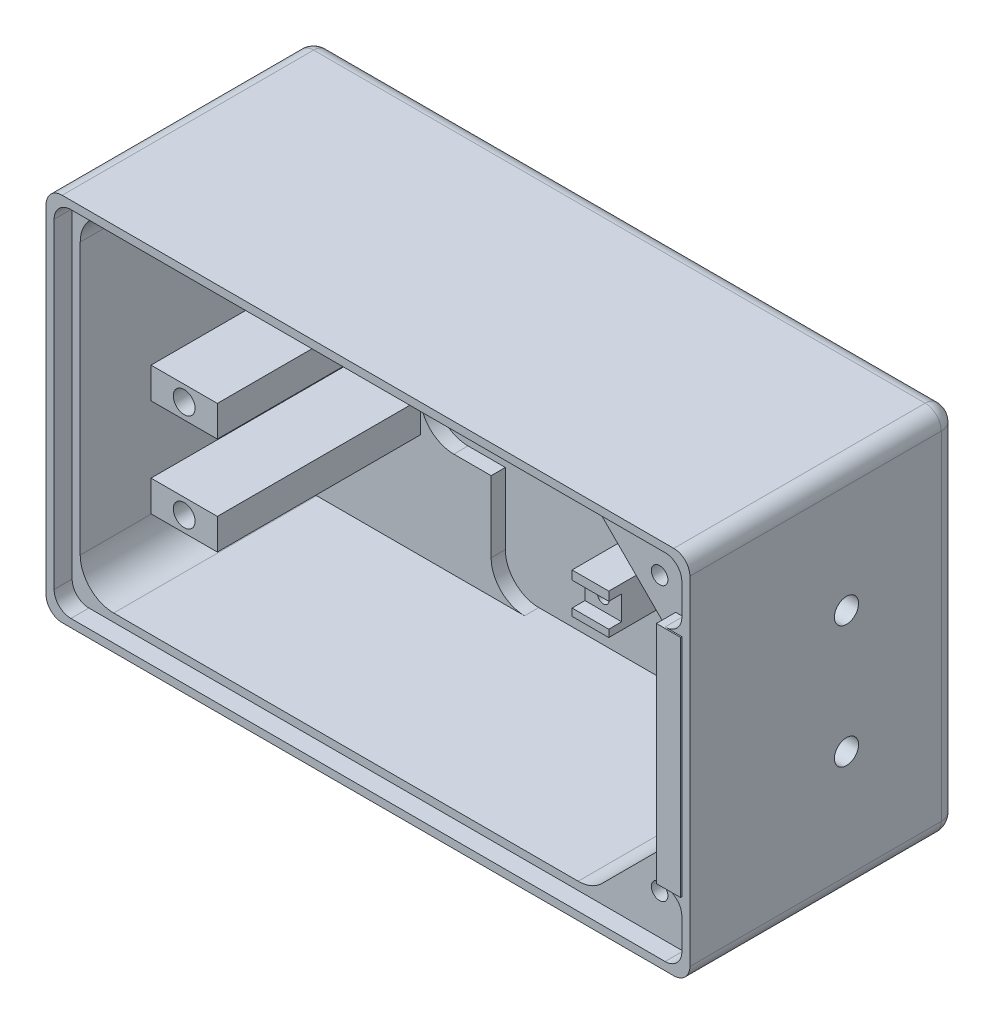
from build123d import *

# Parameters (mm, degrees)
SKETCH1_W                                         = 127
SKETCH1_H                                         = 73.025
BOSS_EXTRUDE1_DEPTH                               = 38.1
SKETCH2_W                                         = 73.025
SKETCH2_H                                         = 66.675
SKETCH2_W_2                                       = 15.24
CUT_EXTRUDE1_DEPTH                                = 31.75
SKETCH3_W                                         = 28.575
SKETCH3_H                                         = 66.675
CUT_EXTRUDE2_DEPTH                                = 1.620624902
SKETCH4_W                                         = 12.7
SKETCH4_H                                         = 22.225
BOSS_EXTRUDE2_DEPTH                               = 30.129375098
SKETCH5_W                                         = 29.845
SKETCH5_H                                         = 66.675
CUT_EXTRUDE3_DEPTH                                = 30.129375098
SKETCH8_W                                         = 7.239
SKETCH8_H                                         = 31.75
BOSS_EXTRUDE3_DEPTH                               = 17.9705
CUT_EXTRUDE4_DEPTH                                = 18.6055
SKETCH7_W                                         = 127
SKETCH7_H                                         = 73.025
CUT_EXTRUDE5_DEPTH                                = 1.620624902
SKETCH9_W                                         = 33.528
SKETCH9_H                                         = 15.875
CUT_EXTRUDE6_DEPTH                                = 17.9705
SKETCH11_W                                        = 127
SKETCH11_H                                        = 73.025
SKETCH11_W_2                                      = 116.84
SKETCH11_H_2                                      = 66.675
BOSS_EXTRUDE4_DEPTH                               = 12.733124902
F_4_40_TAPPED_HOLE1_D                             = 2.2606
F_4_40_TAPPED_HOLE1_DEPTH                         = 7.62
F_4_40_TAPPED_HOLE1_TIP                           = 0.679152758
CHAMFER1_SIZE                                     = 15.875
FILLET2_R                                         = 6.604
CUT_EXTRUDE8_START                                = -30.129375098
CUT_EXTRUDE8_DEPTH                                = 30.129375098
SKETCH15_W                                        = 41.000000042
SKETCH15_H                                        = 20.6375
BOSS_EXTRUDE5_DEPTH                               = 2.8034996
SKETCH16_W                                        = 13.081
SKETCH16_H                                        = 6.096
BOSS_EXTRUDE6_DEPTH                               = 42.8625
FILLET3_R                                         = 6.604
FILLET4_R                                         = 3.175
CSK_FOR_8_FLAT_HEAD_SOCKET_CAP_SCREW1_D           = 4.3053
CSK_FOR_8_FLAT_HEAD_SOCKET_CAP_SCREW1_CSINK_D     = 9.1186
CSK_FOR_8_FLAT_HEAD_SOCKET_CAP_SCREW1_CSINK_ANGLE = 82
CUT_EXTRUDE9_REACH                                = 143.011
SKETCH22_R                                        = 2.3876
F_4_40_TAPPED_HOLE3_D                             = 2.2606
F_4_40_TAPPED_HOLE3_DEPTH                         = 12.7
F_4_40_TAPPED_HOLE3_TIP                           = 0.679152758
CBORE_FOR_4_SOCKET_HEAD_CAP_SCREW1_D              = 3.2639
CBORE_FOR_4_SOCKET_HEAD_CAP_SCREW1_CBORE_D        = 6.35
CBORE_FOR_4_SOCKET_HEAD_CAP_SCREW1_CBORE_DEPTH    = 12.4968
SKETCH30_R                                        = 3.175
CUT_EXTRUDE10_DEPTH                               = 9.525
SKETCH31_W                                        = 6.35
SKETCH31_H                                        = 44.45
BOSS_EXTRUDE7_DEPTH                               = 3.81
SKETCH32_W                                        = 7.239
SKETCH32_H                                        = 31.75
CUT_EXTRUDE11_DEPTH                               = 2.286
BOSS_EXTRUDE9_START                               = -2.8034996
BOSS_EXTRUDE9_DEPTH                               = 2.8034996
BOSS_EXTRUDE10_DEPTH                              = 3.81
BOSS_EXTRUDE11_DEPTH                              = 3.81
SKETCH36_W                                        = 4.7625
SKETCH36_H                                        = 44.45
CUT_EXTRUDE12_DEPTH                               = 0.254
CUT_EXTRUDE14_DEPTH                               = 1.5875
CUT_EXTRUDE15_DEPTH                               = 0.254


with BuildPart() as part:
    # Sketch1 → Boss-Extrude1 (new body)
    with BuildSketch(Plane.XY):
        Rectangle(SKETCH1_W, SKETCH1_H)
    extrude(amount=BOSS_EXTRUDE1_DEPTH)

    # Sketch2 → Cut-Extrude1 (cut)
    with BuildSketch(Plane.XY.offset(38.1)):
        with Locations((20.0025, 0)):
            Rectangle(SKETCH2_W, SKETCH2_H)
        with Locations((-52.705, 0)):
            Rectangle(SKETCH2_W_2, SKETCH2_H)
    extrude(amount=-CUT_EXTRUDE1_DEPTH, mode=Mode.SUBTRACT)

    # Sketch3 → Cut-Extrude2 (cut)
    with BuildSketch(Plane.XY.offset(38.1)):
        with Locations((-30.7975, 0)):
            Rectangle(SKETCH3_W, SKETCH3_H)
    extrude(amount=-CUT_EXTRUDE2_DEPTH, mode=Mode.SUBTRACT)

    # Sketch4 → Boss-Extrude2 (add)
    with BuildSketch(Plane.XY.offset(36.479375098)):
        with Locations((-10.16, -22.225)):
            Rectangle(SKETCH4_W, SKETCH4_H)
        with Locations((-10.16, 22.225)):
            Rectangle(SKETCH4_W, SKETCH4_H)
    extrude(amount=-BOSS_EXTRUDE2_DEPTH)

    # Sketch5 → Cut-Extrude3 (cut)
    with BuildSketch(Plane.XY.offset(36.479375098)):
        with Locations((-30.1625, 0)):
            Rectangle(SKETCH5_W, SKETCH5_H)
    extrude(amount=-CUT_EXTRUDE3_DEPTH, mode=Mode.SUBTRACT)

    # Sketch8 → Boss-Extrude3 (add)
    with BuildSketch(Plane.XY.offset(6.35)):
        with Locations((13.1445, 0)):
            Rectangle(SKETCH8_W, SKETCH8_H)
    extrude(amount=BOSS_EXTRUDE3_DEPTH)

    # Sketch6 → Cut-Extrude4 (cut)
    with BuildSketch(Plane.XY.offset(38.1)):
        with BuildLine():
            Line((6.35, 14.44625), (53.975, 14.44625))
            ThreePointArc((53.975, 14.44625), (56.35625, 12.065), (53.975, 9.68375))
            Line((53.975, 9.68375), (6.35, 9.68375))
            ThreePointArc((6.35, 9.68375), (3.96875, 12.065), (6.35, 14.44625))
        make_face()
        with BuildLine():
            Line((6.35, -14.44625), (53.975, -14.44625))
            ThreePointArc((53.975, -14.44625), (56.35625, -12.065), (53.975, -9.68375))
            Line((53.975, -9.68375), (6.35, -9.68375))
            ThreePointArc((6.35, -9.68375), (3.96875, -12.065), (6.35, -14.44625))
        make_face()
    extrude(amount=-CUT_EXTRUDE4_DEPTH, mode=Mode.SUBTRACT)

    # Sketch7 → Cut-Extrude5 (cut)
    with BuildSketch(Plane.XY.offset(38.1)):
        Rectangle(SKETCH7_W, SKETCH7_H)
    extrude(amount=-CUT_EXTRUDE5_DEPTH, mode=Mode.SUBTRACT)

    # Sketch9 → Cut-Extrude6 (cut)
    with BuildSketch(Plane.XY.offset(24.3205)):
        Rectangle(SKETCH9_W, SKETCH9_H)
    extrude(amount=-CUT_EXTRUDE6_DEPTH, mode=Mode.SUBTRACT)

    # Sketch11 → Boss-Extrude4 (add)
    with BuildSketch(Plane.XY.offset(36.479375098)):
        Rectangle(SKETCH11_W, SKETCH11_H)
        with Locations((-1.905, 0)):
            Rectangle(SKETCH11_W_2, SKETCH11_H_2, mode=Mode.SUBTRACT)
    extrude(amount=BOSS_EXTRUDE4_DEPTH)

    # #4-40 Tapped Hole1
    with Locations(Plane.XY.offset(36.479375098)):
        with Locations((-9.525, 19), (-9.525, -19)):
            Hole(F_4_40_TAPPED_HOLE1_D / 2, depth=F_4_40_TAPPED_HOLE1_DEPTH)
            with Locations((0, 0, -(F_4_40_TAPPED_HOLE1_DEPTH + F_4_40_TAPPED_HOLE1_TIP / 2))):  # 118° drill point
                Cone(0, F_4_40_TAPPED_HOLE1_D / 2, F_4_40_TAPPED_HOLE1_TIP, mode=Mode.SUBTRACT)

    # Chamfer1
    chamfer1_edges = [part.edges().sort_by_distance(p)[0] for p in [
        (56.515, -33.3375, 27.78125),
        (56.515, 33.3375, 27.78125),
    ]]
    chamfer(chamfer1_edges, length=CHAMFER1_SIZE)

    # Fillet2
    fillet2_edges = [part.edges().sort_by_distance(p)[0] for p in [
        (40.64, 33.3375, 27.78125),
        (56.515, -17.4625, 27.78125),
        (56.515, 17.4625, 27.78125),
        (40.64, -33.3375, 27.78125),
        (-60.325, 33.3375, 27.78125),
        (-60.325, -33.3375, 27.78125),
        (-3.81, -33.3375, 21.414687549),
        (-3.81, 33.3375, 21.414687549),
        (-15.24, -33.3375, 21.414687549),
        (-15.24, 33.3375, 21.414687549),
    ]]
    fillet(fillet2_edges, radius=FILLET2_R)

    # Sketch14 → Cut-Extrude8 (cut)
    with BuildSketch(Plane.XY.offset(36.479375098).offset(CUT_EXTRUDE8_START)):
        with BuildLine():
            Line((-15.24, -11.1125), (-15.24, -26.7335))
            ThreePointArc((-15.24, -26.7335), (-17.174266817, -31.403233183), (-21.844, -33.3375))
            Line((-21.844, -33.3375), (2.794, -33.3375))
            ThreePointArc((2.794, -33.3375), (-1.875733183, -31.403233183), (-3.81, -26.7335))
            Line((-3.81, -26.7335), (-3.81, -11.1125))
            Line((-3.81, -11.1125), (-15.24, -11.1125))
        make_face()
        with BuildLine():
            Line((-3.81, 11.1125), (-3.81, 26.7335))
            ThreePointArc((-3.81, 26.7335), (-1.875733183, 31.403233183), (2.794, 33.3375))
            Line((2.794, 33.3375), (-21.844, 33.3375))
            ThreePointArc((-21.844, 33.3375), (-17.174266817, 31.403233183), (-15.24, 26.7335))
            Line((-15.24, 26.7335), (-15.24, 11.1125))
            Line((-15.24, 11.1125), (-3.81, 11.1125))
        make_face()
    extrude(amount=CUT_EXTRUDE8_DEPTH, mode=Mode.SUBTRACT)

    # Sketch15 → Boss-Extrude5 (add)
    with BuildSketch(Plane.XY.offset(6.35)):
        with Locations((-39.824999979, 23.01875)):
            Rectangle(SKETCH15_W, SKETCH15_H)
        with Locations((-39.824999979, -23.01875)):
            Rectangle(SKETCH15_W, SKETCH15_H)
    extrude(amount=BOSS_EXTRUDE5_DEPTH)

    # Sketch16 → Boss-Extrude6 (add)
    with BuildSketch(Plane.XY.offset(6.35)):
        with Locations((-39.8145, 9.652)):
            Rectangle(SKETCH16_W, SKETCH16_H)
        with Locations((-39.8145, -9.652)):
            Rectangle(SKETCH16_W, SKETCH16_H)
    extrude(amount=BOSS_EXTRUDE6_DEPTH)

    # Fillet3
    # the kernel refuses this fillet: 6.604 mm, written as the material it adds along each edge
    with BuildSketch(Plane(origin=(-19.324999958, -33.3375, -10.16), x_dir=(1, 0, 0), z_dir=(0, 0, 1))) as fillet3_piece_1_section:
        with BuildLine():
            CenterArc((FILLET3_R, FILLET3_R), FILLET3_R, 180, 90)
            Line((0, FILLET3_R), (0, 0))
            Line((0, 0), (FILLET3_R, 0))
        make_face()
    fillet3_piece_1 = extrude(amount=19.3134996, mode=Mode.PRIVATE)
    fillet3_piece_1 = split(fillet3_piece_1, bisect_by=Plane(origin=(-17.849878089, -31.862378131, 0), z_dir=(0, 0, 1)), keep=Keep.TOP, mode=Mode.PRIVATE)
    add(fillet3_piece_1)
    with BuildSketch(Plane(origin=(-19.324999958, 33.3375, -10.16), x_dir=(1, 0, 0), z_dir=(0, 0, 1))) as fillet3_piece_2_section:
        with BuildLine():
            CenterArc((FILLET3_R, -FILLET3_R), FILLET3_R, 90, 90)
            Line((0, -FILLET3_R), (0, 0))
            Line((0, 0), (FILLET3_R, 0))
        make_face()
    fillet3_piece_2 = extrude(amount=19.3134996, mode=Mode.PRIVATE)
    fillet3_piece_2 = split(fillet3_piece_2, bisect_by=Plane(origin=(-17.849878089, 31.862378131, 0), z_dir=(0, 0, 1)), keep=Keep.TOP, mode=Mode.PRIVATE)
    add(fillet3_piece_2)
    with BuildSketch(Plane(origin=(-33.274, 12.7, -10.111081374), x_dir=(1, 0, 0), z_dir=(0, 0, 1))) as fillet3_piece_3_section:
        with BuildLine():
            CenterArc((6.58443255, -6.604), FILLET3_R, 90, 85.588274214)
            Line((0, -6.096), (0, 0))
            Line((0, 0), (6.58443255, 0))
        make_face()
    fillet3_piece_3 = extrude(amount=19.264580974, mode=Mode.PRIVATE)
    fillet3_piece_3 = split(fillet3_piece_3, bisect_by=Plane(origin=(-31.18507504, 10.951703165, 0), z_dir=(0, 0, 1)), keep=Keep.TOP, mode=Mode.PRIVATE)
    add(fillet3_piece_3)
    with BuildSketch(Plane(origin=(-33.274, -12.7, -10.111081374), x_dir=(0, 1, 0), z_dir=(0, 0, 1))) as fillet3_piece_4_section:
        with BuildLine():
            CenterArc((6.604, -6.58443255), FILLET3_R, 94.411725786, 85.588274214)
            Line((0, -6.58443255), (0, 0))
            Line((0, 0), (6.096, 0))
        make_face()
    fillet3_piece_4 = extrude(amount=19.264580974, mode=Mode.PRIVATE)
    fillet3_piece_4 = split(fillet3_piece_4, bisect_by=Plane(origin=(-31.18507504, -10.951703165, 0), z_dir=(0, 0, 1)), keep=Keep.TOP, mode=Mode.PRIVATE)
    add(fillet3_piece_4)
    with BuildSketch(Plane(origin=(-46.355, -12.7, -10.111081374), x_dir=(-1, 0, 0), z_dir=(0, 0, 1))) as fillet3_piece_5_section:
        with BuildLine():
            CenterArc((6.58443255, -6.604), FILLET3_R, 90, 85.588274214)
            Line((0, -6.096), (0, 0))
            Line((0, 0), (6.58443255, 0))
        make_face()
    fillet3_piece_5 = extrude(amount=19.264580974, mode=Mode.PRIVATE)
    fillet3_piece_5 = split(fillet3_piece_5, bisect_by=Plane(origin=(-48.44392496, -10.951703165, 0), z_dir=(0, 0, 1)), keep=Keep.TOP, mode=Mode.PRIVATE)
    add(fillet3_piece_5)
    with BuildSketch(Plane(origin=(-60.325, -12.7, -10.16), x_dir=(0, 1, 0), z_dir=(0, 0, 1))) as fillet3_piece_6_section:
        with BuildLine():
            CenterArc((FILLET3_R, -FILLET3_R), FILLET3_R, 90, 90)
            Line((0, -FILLET3_R), (0, 0))
            Line((0, 0), (FILLET3_R, 0))
        make_face()
    fillet3_piece_6 = extrude(amount=19.3134996, mode=Mode.PRIVATE)
    fillet3_piece_6 = split(fillet3_piece_6, bisect_by=Plane(origin=(-58.849878131, -11.224878131, 0), z_dir=(0, 0, 1)), keep=Keep.TOP, mode=Mode.PRIVATE)
    add(fillet3_piece_6)
    with BuildSketch(Plane(origin=(-46.355, 12.7, -10.111081374), x_dir=(-1, 0, 0), z_dir=(0, 0, 1))) as fillet3_piece_7_section:
        with BuildLine():
            CenterArc((6.58443255, 6.604), FILLET3_R, 184.411725786, 85.588274214)
            Line((0, 6.096), (0, 0))
            Line((0, 0), (6.58443255, 0))
        make_face()
    fillet3_piece_7 = extrude(amount=19.264580974, mode=Mode.PRIVATE)
    fillet3_piece_7 = split(fillet3_piece_7, bisect_by=Plane(origin=(-48.44392496, 10.951703165, 0), z_dir=(0, 0, 1)), keep=Keep.TOP, mode=Mode.PRIVATE)
    add(fillet3_piece_7)
    with BuildSketch(Plane(origin=(-60.325, 12.7, -10.16), x_dir=(0, -1, 0), z_dir=(0, 0, 1))) as fillet3_piece_8_section:
        with BuildLine():
            CenterArc((FILLET3_R, FILLET3_R), FILLET3_R, 180, 90)
            Line((0, FILLET3_R), (0, 0))
            Line((0, 0), (FILLET3_R, 0))
        make_face()
    fillet3_piece_8 = extrude(amount=19.3134996, mode=Mode.PRIVATE)
    fillet3_piece_8 = split(fillet3_piece_8, bisect_by=Plane(origin=(-58.849878131, 11.224878131, 0), z_dir=(0, 0, 1)), keep=Keep.TOP, mode=Mode.PRIVATE)
    add(fillet3_piece_8)

    # Fillet4
    fillet4_edges = [part.edges().sort_by_distance(p)[0] for p in [
        (-63.5, 36.5125, 24.60625),
        (63.5, 36.5125, 24.60625),
        (63.5, -36.5125, 24.60625),
        (-63.5, -36.5125, 24.60625),
        (0, 36.5125, 0),
        (63.5, 0, 0),
        (0, -36.5125, 0),
        (-63.5, 0, 0),
    ]]
    fillet(fillet4_edges, radius=FILLET4_R)

    # CSK for #8 Flat Head Socket Cap Screw1 (through all)
    with Locations(Plane(origin=(0, 0, 0), x_dir=(-1, 0, 0), z_dir=(0, 0, -1))):
        with Locations((39.8145, -9.652), (39.8145, 9.652)):
            CounterSinkHole(CSK_FOR_8_FLAT_HEAD_SOCKET_CAP_SCREW1_D / 2, CSK_FOR_8_FLAT_HEAD_SOCKET_CAP_SCREW1_CSINK_D / 2, counter_sink_angle=CSK_FOR_8_FLAT_HEAD_SOCKET_CAP_SCREW1_CSINK_ANGLE)

    # Sketch22 → Cut-Extrude9 (cut, up to next)
    with BuildSketch(Plane(origin=(63.5, 0, 0), x_dir=(0, 0, -1), z_dir=(1, 0, 0)), mode=Mode.PRIVATE) as cut_extrude9_sk1:
        with Locations(Location((-21.87575, -12.065, 0), (0, 0, 90))):
            Circle(SKETCH22_R)
    cut_extrude9_tool1 = extrude(cut_extrude9_sk1.sketch, amount=-CUT_EXTRUDE9_REACH, mode=Mode.PRIVATE) & part.part
    # Sketch22 → Cut-Extrude9 (cut, up to next)
    with BuildSketch(Plane(origin=(63.5, 0, 0), x_dir=(0, 0, -1), z_dir=(1, 0, 0)), mode=Mode.PRIVATE) as cut_extrude9_sk2:
        with Locations(Location((-21.87575, 12.065, 0), (0, 0, 90))):
            Circle(SKETCH22_R)
    cut_extrude9_tool2 = extrude(cut_extrude9_sk2.sketch, amount=-CUT_EXTRUDE9_REACH, mode=Mode.PRIVATE) & part.part
    add(cut_extrude9_tool1.solids().sort_by_distance((63.5, -12.065, 21.87575))[0], mode=Mode.SUBTRACT)
    add(cut_extrude9_tool2.solids().sort_by_distance((63.5, 12.065, 21.87575))[0], mode=Mode.SUBTRACT)

    # #4-40 Tapped Hole3
    with Locations(Plane.XY.offset(24.3205)):
        with Locations((13.1445, 12.065), (13.1445, -12.065)):
            Hole(F_4_40_TAPPED_HOLE3_D / 2, depth=F_4_40_TAPPED_HOLE3_DEPTH)
            with Locations((0, 0, -(F_4_40_TAPPED_HOLE3_DEPTH + F_4_40_TAPPED_HOLE3_TIP / 2))):  # 118° drill point
                Cone(0, F_4_40_TAPPED_HOLE3_D / 2, F_4_40_TAPPED_HOLE3_TIP, mode=Mode.SUBTRACT)

    # CBORE for #4 Socket Head Cap Screw1 (through all)
    with Locations(Plane(origin=(0, 0, 0), x_dir=(-1, 0, 0), z_dir=(0, 0, -1))):
        with Locations((-53.975, -26.9875), (-53.975, 26.9875)):
            CounterBoreHole(CBORE_FOR_4_SOCKET_HEAD_CAP_SCREW1_D / 2, CBORE_FOR_4_SOCKET_HEAD_CAP_SCREW1_CBORE_D / 2, CBORE_FOR_4_SOCKET_HEAD_CAP_SCREW1_CBORE_DEPTH)

    # Sketch30 → Cut-Extrude10 (cut)
    with BuildSketch(Plane(origin=(0, 0, 0), x_dir=(-1, 0, 0), z_dir=(0, 0, -1))):
        with Locations((53.975, -26.9875)):
            Circle(SKETCH30_R)
        with Locations((53.975, 26.9875)):
            Circle(SKETCH30_R)
    extrude(amount=-CUT_EXTRUDE10_DEPTH, mode=Mode.SUBTRACT)

    # Sketch31 → Boss-Extrude7 (add)
    with BuildSketch(Plane.XY.offset(49.2125)):
        with Locations((60.325, 0)):
            Rectangle(SKETCH31_W, SKETCH31_H)
    extrude(amount=BOSS_EXTRUDE7_DEPTH)

    # Sketch32 → Cut-Extrude11 (cut)
    with BuildSketch(Plane.XY.offset(24.3205)):
        with Locations((13.1445, 0)):
            Rectangle(SKETCH32_W, SKETCH32_H)
    extrude(amount=-CUT_EXTRUDE11_DEPTH, mode=Mode.SUBTRACT)

    # Sketch33 → Boss-Extrude9 (add)
    with BuildSketch(Plane.XY.offset(9.1534996).offset(BOSS_EXTRUDE9_START)):
        with BuildLine():
            Line((-33.274, -6.604), (-46.355, -6.604))
            ThreePointArc((-46.355, -6.604), (-48.452898029, -10.942011143), (-52.93943255, -12.7))
            Line((-52.93943255, -12.7), (-53.721, -12.7))
            ThreePointArc((-53.721, -12.7), (-58.390733183, -10.765733183), (-60.325, -6.096))
            Line((-60.325, -6.096), (-60.325, 6.096))
            ThreePointArc((-60.325, 6.096), (-58.390733183, 10.765733183), (-53.721, 12.7))
            Line((-53.721, 12.7), (-52.93943255, 12.7))
            ThreePointArc((-52.93943255, 12.7), (-48.452898029, 10.942011143), (-46.355, 6.604))
            Line((-46.355, 6.604), (-33.274, 6.604))
            Line((-33.274, 6.604), (-33.274, -6.604))
        make_face()
    extrude(amount=BOSS_EXTRUDE9_DEPTH)

    # Sketch34 → Boss-Extrude10 (add)
    with BuildSketch(Plane.XY.offset(49.2125)):
        with BuildLine():
            Line((61.9125, 22.225), (61.9125, 33.3375))
            ThreePointArc((61.9125, 33.3375), (61.447532015, 34.460032015), (60.325, 34.925))
            Line((60.325, 34.925), (-60.325, 34.925))
            ThreePointArc((-60.325, 34.925), (-61.447532015, 34.460032015), (-61.9125, 33.3375))
            Line((-61.9125, 33.3375), (-61.9125, -33.3375))
            ThreePointArc((-61.9125, -33.3375), (-61.447532015, -34.460032015), (-60.325, -34.925))
            Line((-60.325, -34.925), (60.325, -34.925))
            ThreePointArc((60.325, -34.925), (61.447532015, -34.460032015), (61.9125, -33.3375))
            Line((61.9125, -33.3375), (61.9125, -22.225))
            Line((61.9125, -22.225), (63.5, -22.225))
            Line((63.5, -22.225), (63.5, -33.3375))
            ThreePointArc((63.5, -33.3375), (62.57006403, -35.58256403), (60.325, -36.5125))
            Line((60.325, -36.5125), (-60.325, -36.5125))
            ThreePointArc((-60.325, -36.5125), (-62.57006403, -35.58256403), (-63.5, -33.3375))
            Line((-63.5, -33.3375), (-63.5, 33.3375))
            ThreePointArc((-63.5, 33.3375), (-62.57006403, 35.58256403), (-60.325, 36.5125))
            Line((-60.325, 36.5125), (60.325, 36.5125))
            ThreePointArc((60.325, 36.5125), (62.57006403, 35.58256403), (63.5, 33.3375))
            Line((63.5, 33.3375), (63.5, 22.225))
            Line((63.5, 22.225), (61.9125, 22.225))
        make_face()
    extrude(amount=BOSS_EXTRUDE10_DEPTH)

    # Sketch35 → Boss-Extrude11 (add)
    with BuildSketch(Plane.XY.offset(53.0225)):
        with BuildLine():
            Line((-58.6105, 34.925), (-61.9125, 34.925))
            Line((-61.9125, 34.925), (-61.9125, 31.623))
            ThreePointArc((-61.9125, 31.623), (-60.945366591, 33.957866591), (-58.6105, 34.925))
        make_face()
        with BuildLine():
            Line((58.6105, 34.925), (61.9125, 34.925))
            Line((61.9125, 34.925), (61.9125, 31.623))
            ThreePointArc((61.9125, 31.623), (60.945366591, 33.957866591), (58.6105, 34.925))
        make_face()
        with BuildLine():
            Line((61.9125, 25.527), (61.9125, 22.225))
            Line((61.9125, 22.225), (58.6105, 22.225))
            ThreePointArc((58.6105, 22.225), (60.945366591, 23.192133409), (61.9125, 25.527))
        make_face()
        with BuildLine():
            Line((61.9125, -22.225), (58.6105, -22.225))
            ThreePointArc((58.6105, -22.225), (60.945366591, -23.192133409), (61.9125, -25.527))
            Line((61.9125, -25.527), (61.9125, -22.225))
        make_face()
        with BuildLine():
            Line((61.9125, -34.925), (61.9125, -31.623))
            ThreePointArc((61.9125, -31.623), (60.945366591, -33.957866591), (58.6105, -34.925))
            Line((58.6105, -34.925), (61.9125, -34.925))
        make_face()
        with BuildLine():
            Line((-61.9125, -34.925), (-61.9125, -31.623))
            ThreePointArc((-61.9125, -31.623), (-60.945366591, -33.957866591), (-58.6105, -34.925))
            Line((-58.6105, -34.925), (-61.9125, -34.925))
        make_face()
    extrude(amount=-BOSS_EXTRUDE11_DEPTH)

    # Sketch36 → Cut-Extrude12 (cut)
    with BuildSketch(Plane.XY.offset(53.0225)):
        with BuildLine():
            Line((63.5, -33.3375), (63.5, 33.3375))
            ThreePointArc((63.5, 33.3375), (62.57006403, 35.58256403), (60.325, 36.5125))
            Line((60.325, 36.5125), (-60.325, 36.5125))
            ThreePointArc((-60.325, 36.5125), (-62.57006403, 35.58256403), (-63.5, 33.3375))
            Line((-63.5, 33.3375), (-63.5, -33.3375))
            ThreePointArc((-63.5, -33.3375), (-62.57006403, -35.58256403), (-60.325, -36.5125))
            Line((-60.325, -36.5125), (60.325, -36.5125))
            ThreePointArc((60.325, -36.5125), (62.57006403, -35.58256403), (63.5, -33.3375))
        make_face()
        with Locations((59.53125, 0)):
            Rectangle(SKETCH36_W, SKETCH36_H, mode=Mode.SUBTRACT)
    extrude(amount=-CUT_EXTRUDE12_DEPTH, mode=Mode.SUBTRACT)

    # Sketch38 → Cut-Extrude14 (cut)
    with BuildSketch(Plane.XY.offset(6.35)):
        with BuildLine():
            Line((-26.67, 6.604), (26.67, 6.604))
            ThreePointArc((26.67, 6.604), (33.274, 0), (26.67, -6.604))
            Line((26.67, -6.604), (-26.67, -6.604))
            ThreePointArc((-26.67, -6.604), (-33.274, 0), (-26.67, 6.604))
        make_face()
    extrude(amount=-CUT_EXTRUDE14_DEPTH, mode=Mode.SUBTRACT)

    # Sketch39 → Cut-Extrude15 (cut)
    with BuildSketch(Plane(origin=(0, 0, 0), x_dir=(-1, 0, 0), z_dir=(0, 0, -1))):
        with BuildLine():
            Line((29.24175, -13.49375), (-41.94175, -13.49375))
            ThreePointArc((-41.94175, -13.49375), (-44.276616591, -12.526616591), (-45.24375, -10.19175))
            Line((-45.24375, -10.19175), (-45.24375, 10.19175))
            ThreePointArc((-45.24375, 10.19175), (-44.276616591, 12.526616591), (-41.94175, 13.49375))
            Line((-41.94175, 13.49375), (29.24175, 13.49375))
            ThreePointArc((29.24175, 13.49375), (31.576616591, 12.526616591), (32.54375, 10.19175))
            Line((32.54375, 10.19175), (32.54375, -10.19175))
            ThreePointArc((32.54375, -10.19175), (31.576616591, -12.526616591), (29.24175, -13.49375))
        make_face()
    extrude(amount=-CUT_EXTRUDE15_DEPTH, mode=Mode.SUBTRACT)


solid = part.part
